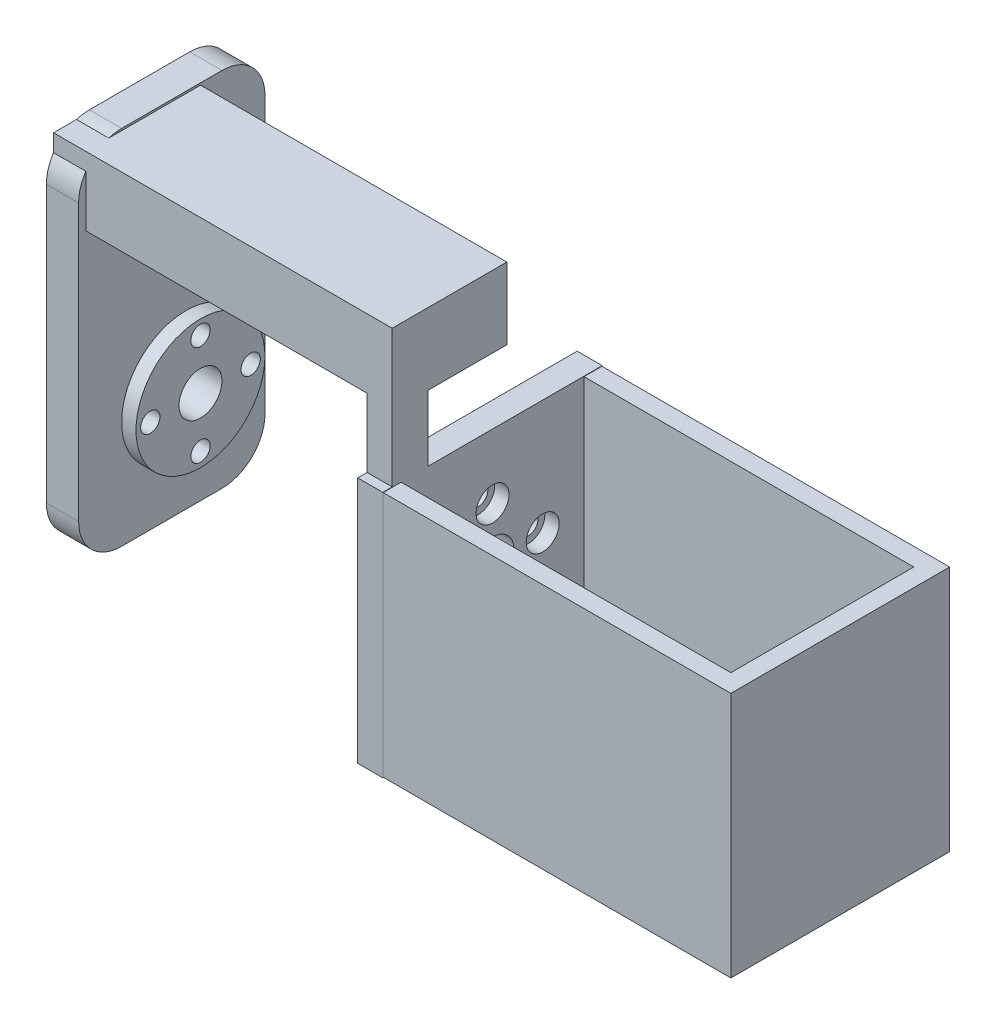
from build123d import *

# Parameters (mm, degrees)
S_PRISM1_W    = 30.62
S_PRISM1_H    = 34.5
BOSS_1_DEPTH  = 3.5
S_CYL2_R      = 9
BOSS_2_DEPTH  = 2
BOSS_3_DEPTH  = 4.5
S_BOX4_W      = 2.5
S_BOX4_H      = 34.4
BOSS_4_DEPTH  = 30.52
S_BOX5_W      = 2.5
S_BOX5_H      = 34.4
BOSS_5_DEPTH  = 30.52
S_BOX6_W      = 51.02
S_BOX6_H      = 34.4
BOSS_6_DEPTH  = 2.5
S_BOX7_W      = 51.02
S_BOX7_H      = 34.4
BOSS_7_DEPTH  = 2.5
S_BOX8_W      = 51.02
S_BOX8_H      = 2.4
BOSS_8_DEPTH  = 30.52
S_BOX9_W      = 3.5
S_BOX9_H      = 9.725
BOSS_9_DEPTH  = 5
S_BOX10_W     = 3.5
S_BOX10_H     = 10
BOSS_10_DEPTH = 16
S_BOX11_W     = 47.25
S_BOX11_H     = 9.6
BOSS_11_DEPTH = 16
S_HOLE12_R    = 3
HOLE_12_DEPTH = 3.7
S_HOLE13_R    = 1.35
HOLE_13_DEPTH = 3.7
S_HOLE14_R    = 1.35
HOLE_14_DEPTH = 3.7
S_HOLE15_R    = 1.35
HOLE_15_DEPTH = 3.7
S_HOLE16_R    = 1.35
HOLE_16_DEPTH = 3.7
S_HOLE17_R    = 3
HOLE_17_DEPTH = 6.7
S_HOLE18_R    = 1.35
HOLE_18_DEPTH = 6.7
S_HOLE19_R    = 1.35
HOLE_19_DEPTH = 6.7
S_HOLE20_R    = 1.35
HOLE_20_DEPTH = 6.7
S_HOLE21_R    = 1.35
HOLE_21_DEPTH = 6.7
S_HOLE22_R    = 11
HOLE_22_DEPTH = 2.6
S_HOLE23_R    = 1.1
HOLE_23_DEPTH = 2.6
S_HOLE24_R    = 1.1
HOLE_24_DEPTH = 2.6
S_HOLE25_R    = 1.1
HOLE_25_DEPTH = 2.6
S_HOLE26_R    = 2.3
HOLE_26_DEPTH = 2.1
S_HOLE27_R    = 2.3
HOLE_27_DEPTH = 2.1
S_HOLE28_R    = 2.3
HOLE_28_DEPTH = 2.1
S_HOLE29_R    = 2.3
HOLE_29_DEPTH = 2.1


with BuildPart() as part:
    # S_prism1 → Boss_1 (new body)
    with BuildSketch(Plane(origin=(-14.01, 0, 0), x_dir=(0, 0, -1), z_dir=(1, 0, 0))):
        with Locations((0, -1.2)):
            Rectangle(S_PRISM1_W, S_PRISM1_H)
    extrude(amount=BOSS_1_DEPTH)

    # S_box4 → Boss_4 (add)
    with BuildSketch(Plane.XY.offset(-15.26)):
        with Locations((-11.76, -1.2)):
            Rectangle(S_BOX4_W, S_BOX4_H)
    extrude(amount=BOSS_4_DEPTH)



with BuildPart() as body_2:
    # S_cyl2 → Boss_2 (new body)
    with BuildSketch(Plane(origin=(-53.26, 0, 0), x_dir=(0, 0, -1), z_dir=(1, 0, 0))):
        Circle(S_CYL2_R)
    extrude(amount=BOSS_2_DEPTH)

    # S_prism3 → Boss_3 (add)
    with BuildSketch(Plane(origin=(-57.76, 0, 0), x_dir=(0, 0, -1), z_dir=(1, 0, 0))):
        with BuildLine():
            Line((11, -9), (11, 29.5))
            ThreePointArc((11, 29.5), (9.2426, 33.7426), (5, 35.5))
            Line((5, 35.5), (-9, 35.5))
            ThreePointArc((-9, 35.5), (-13.2426, 33.7426), (-15, 29.5))
            Line((-15, 29.5), (-15, -9))
            ThreePointArc((-15, -9), (-13.2426, -13.2426), (-9, -15))
            Line((-9, -15), (5, -15))
            ThreePointArc((5, -15), (9.2426, -13.2426), (11, -9))
        make_face()
    extrude(amount=BOSS_3_DEPTH)


with BuildPart() as body_3:
    # S_box5 → Boss_5 (new body)
    with BuildSketch(Plane.XY.offset(-15.26)):
        with Locations((36.76, -1.2)):
            Rectangle(S_BOX5_W, S_BOX5_H)
    extrude(amount=BOSS_5_DEPTH)


with BuildPart() as part_1:
    add(part.part)

    add(body_3.part)  # Boss_6 merges body 3
    # S_box6 → Boss_6 (add)
    with BuildSketch(Plane.XY.offset(-15.26)):
        with Locations((12.5, -1.2)):
            Rectangle(S_BOX6_W, S_BOX6_H)
    extrude(amount=BOSS_6_DEPTH)

    # S_box7 → Boss_7 (add)
    with BuildSketch(Plane.XY.offset(12.76)):
        with Locations((12.5, -1.2)):
            Rectangle(S_BOX7_W, S_BOX7_H)
    extrude(amount=BOSS_7_DEPTH)

    # S_box8 → Boss_8 (add)
    with BuildSketch(Plane.XY.offset(-15.26)):
        with Locations((12.5, -17.2)):
            Rectangle(S_BOX8_W, S_BOX8_H)
    extrude(amount=BOSS_8_DEPTH)

    # S_box9 → Boss_9 (add)
    with BuildSketch(Plane.XY.offset(9)):
        with Locations((-12.26, 20.8625)):
            Rectangle(S_BOX9_W, S_BOX9_H)
    extrude(amount=BOSS_9_DEPTH)

    # S_box10 → Boss_10 (add)
    with BuildSketch(Plane.XY.offset(-2)):
        with Locations((-12.26, 30.225)):
            Rectangle(S_BOX10_W, S_BOX10_H)
    extrude(amount=BOSS_10_DEPTH)


    add(body_2.part)  # Boss_11 merges body 2
    # S_box11 → Boss_11 (add)
    with BuildSketch(Plane.XY.offset(-2)):
        with Locations((-34.135, 30.425)):
            Rectangle(S_BOX11_W, S_BOX11_H)
    extrude(amount=BOSS_11_DEPTH)

    # S_hole12 → Hole_12 (cut)
    with BuildSketch(Plane(origin=(-14.11, 0, 0), x_dir=(0, 0, -1), z_dir=(1, 0, 0))):
        Circle(S_HOLE12_R)
    extrude(amount=HOLE_12_DEPTH, mode=Mode.SUBTRACT)

    # S_hole13 → Hole_13 (cut)
    with BuildSketch(Plane(origin=(-14.11, 0, 0), x_dir=(0, 0, -1), z_dir=(1, 0, 0))):
        with Locations((0, 7)):
            Circle(S_HOLE13_R)
    extrude(amount=HOLE_13_DEPTH, mode=Mode.SUBTRACT)

    # S_hole14 → Hole_14 (cut)
    with BuildSketch(Plane(origin=(-14.11, 0, 0), x_dir=(0, 0, -1), z_dir=(1, 0, 0))):
        with Locations((-7, 0)):
            Circle(S_HOLE14_R)
    extrude(amount=HOLE_14_DEPTH, mode=Mode.SUBTRACT)

    # S_hole15 → Hole_15 (cut)
    with BuildSketch(Plane(origin=(-14.11, 0, 0), x_dir=(0, 0, -1), z_dir=(1, 0, 0))):
        with Locations((0, -7)):
            Circle(S_HOLE15_R)
    extrude(amount=HOLE_15_DEPTH, mode=Mode.SUBTRACT)

    # S_hole16 → Hole_16 (cut)
    with BuildSketch(Plane(origin=(-14.11, 0, 0), x_dir=(0, 0, -1), z_dir=(1, 0, 0))):
        with Locations((7, 0)):
            Circle(S_HOLE16_R)
    extrude(amount=HOLE_16_DEPTH, mode=Mode.SUBTRACT)

    # S_hole17 → Hole_17 (cut)
    with BuildSketch(Plane(origin=(-57.86, 0, 0), x_dir=(0, 0, -1), z_dir=(1, 0, 0))):
        Circle(S_HOLE17_R)
    extrude(amount=HOLE_17_DEPTH, mode=Mode.SUBTRACT)

    # S_hole18 → Hole_18 (cut)
    with BuildSketch(Plane(origin=(-57.86, 0, 0), x_dir=(0, 0, -1), z_dir=(1, 0, 0))):
        with Locations((0, 7)):
            Circle(S_HOLE18_R)
    extrude(amount=HOLE_18_DEPTH, mode=Mode.SUBTRACT)

    # S_hole19 → Hole_19 (cut)
    with BuildSketch(Plane(origin=(-57.86, 0, 0), x_dir=(0, 0, -1), z_dir=(1, 0, 0))):
        with Locations((-7, 0)):
            Circle(S_HOLE19_R)
    extrude(amount=HOLE_19_DEPTH, mode=Mode.SUBTRACT)

    # S_hole20 → Hole_20 (cut)
    with BuildSketch(Plane(origin=(-57.86, 0, 0), x_dir=(0, 0, -1), z_dir=(1, 0, 0))):
        with Locations((0, -7)):
            Circle(S_HOLE20_R)
    extrude(amount=HOLE_20_DEPTH, mode=Mode.SUBTRACT)

    # S_hole21 → Hole_21 (cut)
    with BuildSketch(Plane(origin=(-57.86, 0, 0), x_dir=(0, 0, -1), z_dir=(1, 0, 0))):
        with Locations((7, 0)):
            Circle(S_HOLE21_R)
    extrude(amount=HOLE_21_DEPTH, mode=Mode.SUBTRACT)

    # S_hole22 → Hole_22 (cut)
    with BuildSketch(Plane(origin=(0, -18.5, 0), x_dir=(1, 0, 0), z_dir=(0, 1, 0))):
        Circle(S_HOLE22_R)
    extrude(amount=HOLE_22_DEPTH, mode=Mode.SUBTRACT)

    # S_hole23 → Hole_23 (cut)
    with BuildSketch(Plane(origin=(0, -18.5, 0), x_dir=(1, 0, 0), z_dir=(0, 1, 0))):
        with Locations((8.3, -10.25)):
            Circle(S_HOLE23_R)
    extrude(amount=HOLE_23_DEPTH, mode=Mode.SUBTRACT)

    # S_hole24 → Hole_24 (cut)
    with BuildSketch(Plane(origin=(0, -18.5, 0), x_dir=(1, 0, 0), z_dir=(0, 1, 0))):
        with Locations((32.75, 10.25)):
            Circle(S_HOLE24_R)
    extrude(amount=HOLE_24_DEPTH, mode=Mode.SUBTRACT)

    # S_hole25 → Hole_25 (cut)
    with BuildSketch(Plane(origin=(0, -18.5, 0), x_dir=(1, 0, 0), z_dir=(0, 1, 0))):
        with Locations((32.75, -10.25)):
            Circle(S_HOLE25_R)
    extrude(amount=HOLE_25_DEPTH, mode=Mode.SUBTRACT)

    # S_hole26 → Hole_26 (cut)
    with BuildSketch(Plane(origin=(-12.51, 0, 0), x_dir=(0, 0, -1), z_dir=(1, 0, 0))):
        with Locations((0, 7)):
            Circle(S_HOLE26_R)
    extrude(amount=HOLE_26_DEPTH, mode=Mode.SUBTRACT)

    # S_hole27 → Hole_27 (cut)
    with BuildSketch(Plane(origin=(-12.51, 0, 0), x_dir=(0, 0, -1), z_dir=(1, 0, 0))):
        with Locations((-7, 0)):
            Circle(S_HOLE27_R)
    extrude(amount=HOLE_27_DEPTH, mode=Mode.SUBTRACT)

    # S_hole28 → Hole_28 (cut)
    with BuildSketch(Plane(origin=(-12.51, 0, 0), x_dir=(0, 0, -1), z_dir=(1, 0, 0))):
        with Locations((0, -7)):
            Circle(S_HOLE28_R)
    extrude(amount=HOLE_28_DEPTH, mode=Mode.SUBTRACT)

    # S_hole29 → Hole_29 (cut)
    with BuildSketch(Plane(origin=(-12.51, 0, 0), x_dir=(0, 0, -1), z_dir=(1, 0, 0))):
        with Locations((7, 0)):
            Circle(S_HOLE29_R)
    extrude(amount=HOLE_29_DEPTH, mode=Mode.SUBTRACT)


solid = part_1.part
